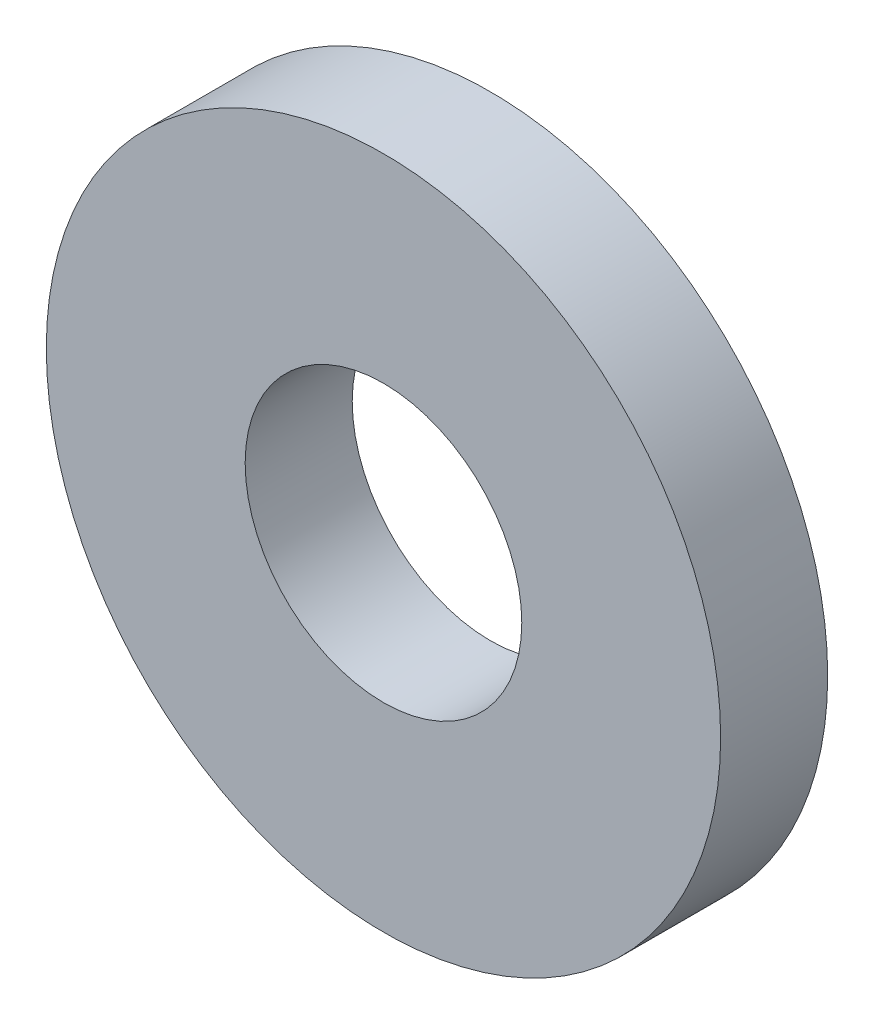
from build123d import *

# Parameters (mm, degrees)
SKETCH1_R                = 10
BOSS_EXTRUDE1_DEPTH      = 1.5875
F_5_16_CLEARANCE_HOLE1_D = 8.2042


with BuildPart() as part:
    # Sketch1 → Boss-Extrude1 (new, symmetric)
    with BuildSketch(Plane.XY):
        Circle(SKETCH1_R)
    extrude(amount=BOSS_EXTRUDE1_DEPTH, both=True)

    # 5/16 Clearance Hole1 (through all)
    with Locations(Plane.XY.offset(1.5875)):
        with Locations((0, 0)):
            Hole(F_5_16_CLEARANCE_HOLE1_D / 2)


solid = part.part
